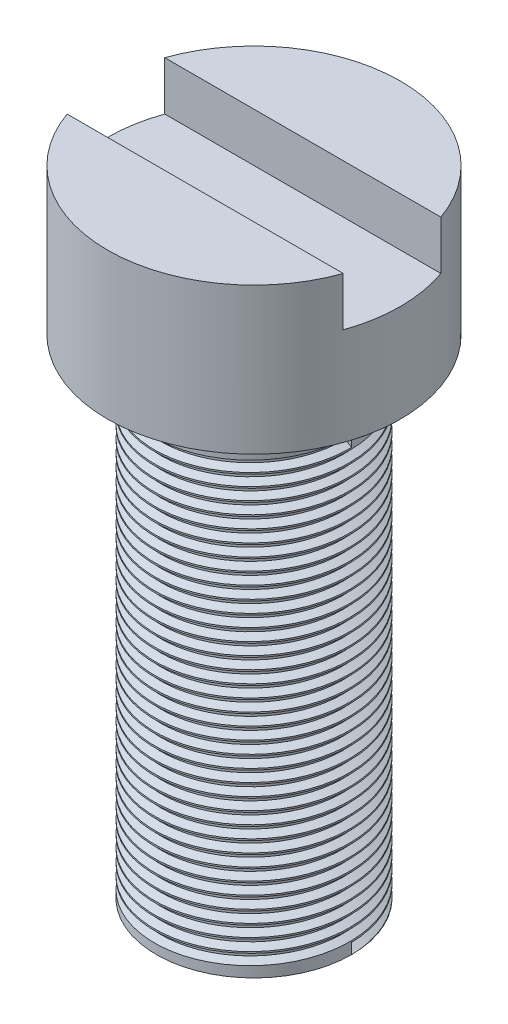
from build123d import *

# Parameters (mm, degrees)
SKETCH1_R           = 15
BOSS_EXTRUDE1_DEPTH = 7.5
SKETCH2_W           = 10
SKETCH2_H           = 5
CUT_EXTRUDE1_DEPTH  = 22.5
SKETCH3_R           = 10
BOSS_EXTRUDE2_DEPTH = 50
THREAD1_PITCH       = 1.25


with BuildPart() as part:
    # Sketch1 → Boss-Extrude1 (new, symmetric)
    with BuildSketch(Plane(origin=(0, 0, 0), x_dir=(1, 0, 0), z_dir=(0, 1, 0))):
        with Locations(Location((0, 0, 0), (0, 0, 270))):
            Circle(SKETCH1_R)
    extrude(amount=BOSS_EXTRUDE1_DEPTH, both=True)

    # Sketch2 → Cut-Extrude1 (cut, symmetric)
    with BuildSketch(Plane(origin=(0, 0, 0), x_dir=(0, 0, -1), z_dir=(1, 0, 0))):
        with Locations((0, 5)):
            Rectangle(SKETCH2_W, SKETCH2_H)
    extrude(amount=CUT_EXTRUDE1_DEPTH, both=True, mode=Mode.SUBTRACT)

    # Sketch3 → Boss-Extrude2 (add)
    with BuildSketch(Plane.XZ.offset(7.5)):
        with Locations(Location((0, 0, 0), (0, 0, 270))):
            Circle(SKETCH3_R)
    extrude(amount=BOSS_EXTRUDE2_DEPTH)

    # Thread1: the profile of Thread Profile1 profile screwed along a right-hand helix of 36 turns, 8 arcs to a turn; built about Z, then put on its axis
    thread1_z = Axis((0, 0, 0), (0, 0, 1))
    thread1_corners = [(10.0003, 0, -0.000173205), (10.0003, 0, 1.093923202), (9.323417656, 0, 0.703124998), (9.323417656, 0, 0.390624998)]
    with BuildLine(mode=Mode.PRIVATE) as thread1_profile:
        Line(thread1_corners[0], thread1_corners[1])
        Line(thread1_corners[1], thread1_corners[2])
        Line(thread1_corners[2], thread1_corners[3])
        Line(thread1_corners[3], thread1_corners[0])
    thread1_cap = Face(thread1_profile.wire())
    thread1_turn_angles = [0, 22.5, 45, 67.5, 90, 112.5, 135, 157.5, 180, 202.5, 225, 247.5, 270, 292.5, 315, 337.5, 360]
    thread1_turn_weights = [1, 0.9238795325112867, 1, 0.9238795325112867, 1, 0.9238795325112867, 1, 0.9238795325112867, 1, 0.9238795325112867, 1, 0.9238795325112867, 1, 0.9238795325112867, 1, 0.9238795325112867, 1]
    thread1_turn_rails = [Edge.make_bspline([Vector(p[0], p[1], 0).rotate(thread1_z, thread1_turn_angles[k]) / thread1_turn_weights[k] + Vector(0, 0, p[2] + THREAD1_PITCH * thread1_turn_angles[k] / 360) for k in range(17)], [0, 0, 0, 1, 1, 2, 2, 3, 3, 4, 4, 5, 5, 6, 6, 7, 7, 8, 8, 8], 2, thread1_turn_weights) for p in thread1_corners]
    thread1_turn_sides = [Face.make_surface_from_curves(thread1_turn_rails[p[0]], thread1_turn_rails[p[1]]) for p in [(0, 1), (1, 2), (2, 3), (3, 0)]]
    thread1 = Plane(origin=(0, -57.5, 0), x_dir=(1, 0, 0), z_dir=(0, 1, 0)) * Solid(Shell([*[p.moved(Location((0, 0, THREAD1_PITCH * i))) for i in range(36) for p in thread1_turn_sides], thread1_cap, thread1_cap.rotate(thread1_z, 12960).moved(Location((0, 0, THREAD1_PITCH * 12960 / 360)))]))
    add(thread1, mode=Mode.SUBTRACT)


solid = part.part
